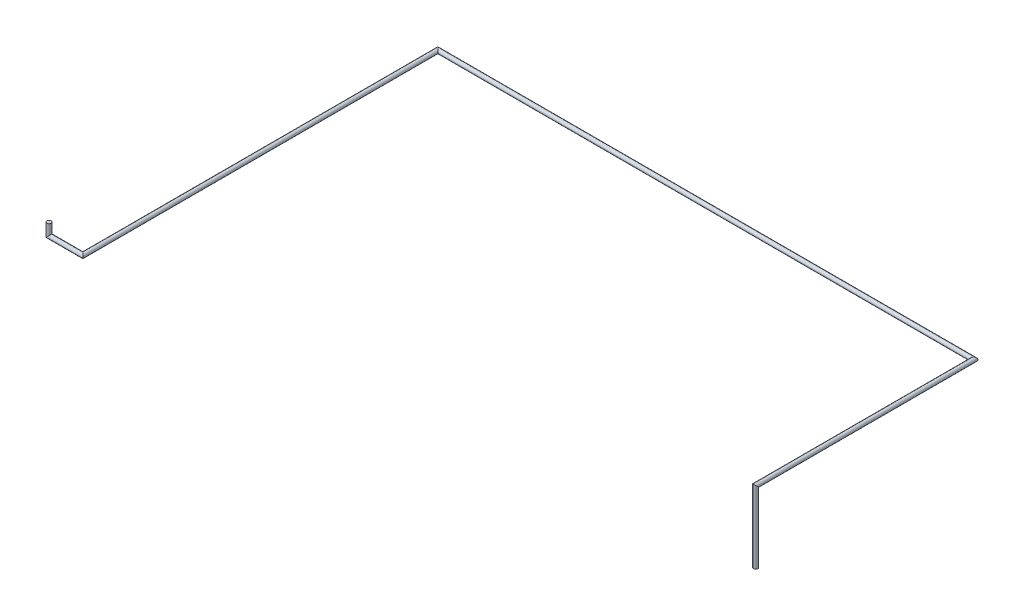
from build123d import *

# Parameters (mm, degrees)
CROQUIS1_R              = 12.7
SALIENTE_EXTRUIR1_DEPTH = 20
CROQUIS2_R              = 12.7
CROQUIS3_W              = 1.2
CROQUIS3_H              = 1.2
SALIENTE_EXTRUIR2_DEPTH = 20


with BuildPart() as part:
    # Croquis1 → Saliente-Extruir1 (new body)
    with BuildSketch(Plane(origin=(0, 0, 0), x_dir=(1, 0, 0), z_dir=(0, 1, 0))):
        Circle(CROQUIS1_R)
    extrude(amount=SALIENTE_EXTRUIR1_DEPTH)

    # Barrer1: sweep along a curve in space
    with BuildLine() as barrer1_path:
        Line((0, 20, 0), (0, 420, 0))
        Line((0, 420, 0), (0, 420, -1290))
        Line((0, 420, -1290), (-3170, 420, -1290))
        Line((-3170, 420, -1290), (-3170, 420, 810))
        Line((-3170, 420, 810), (-3370, 420, 810))
        Line((-3370, 420, 810), (-3370, 490, 810))
    # Croquis2 → Barrer1 (sweep)
    with BuildSketch(Plane(origin=(0, 20, 0), x_dir=(1, 0, 0), z_dir=(0, 1, 0))):
        Circle(CROQUIS2_R)
    sweep(path=barrer1_path.line, transition=Transition.RIGHT)

    # Croquis3 → Saliente-Extruir2 (add)
    with BuildSketch(Plane.XZ):
        with Locations((0, 12.7)):
            Rectangle(CROQUIS3_W, CROQUIS3_H)
    extrude(amount=-SALIENTE_EXTRUIR2_DEPTH)


solid = part.part
